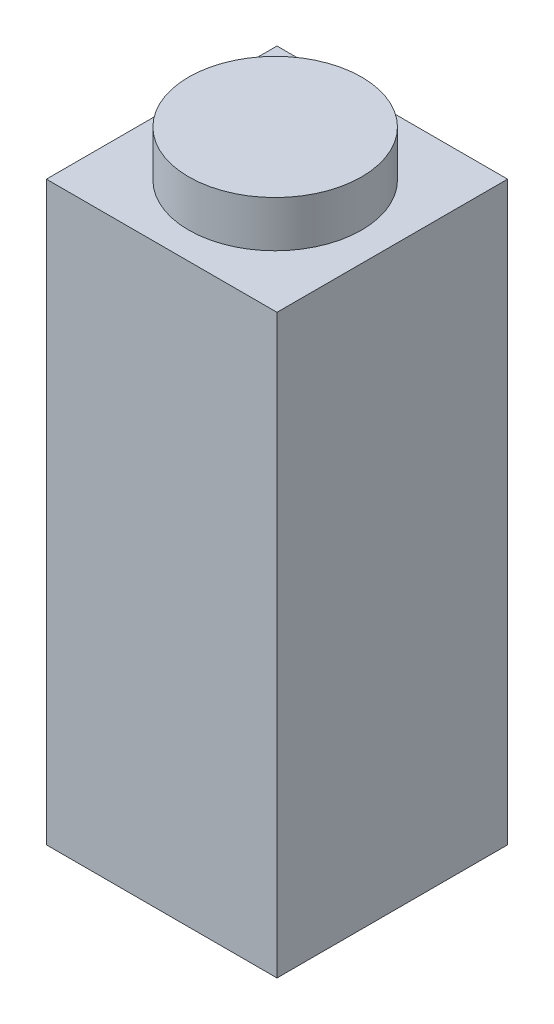
from build123d import *

# Parameters (mm, degrees)
SKETCH1_W           = 6
SKETCH1_H           = 6
BOSS_EXTRUDE1_DEPTH = 15
SKETCH2_R           = 1
CUT_EXTRUDE1_DEPTH  = 0.5
SKETCH4_R           = 2.25
BOSS_EXTRUDE2_DEPTH = 1.2


with BuildPart() as part:
    # Sketch1 → Boss-Extrude1 (new body)
    with BuildSketch(Plane(origin=(0, 0, 0), x_dir=(1, 0, 0), z_dir=(0, 1, 0))):
        Rectangle(SKETCH1_W, SKETCH1_H)
    extrude(amount=BOSS_EXTRUDE1_DEPTH)

    # Sketch2 → Cut-Extrude1 (cut)
    with BuildSketch(Plane.XZ):
        Circle(SKETCH2_R)
    extrude(amount=-CUT_EXTRUDE1_DEPTH, mode=Mode.SUBTRACT)

    # Sketch4 → Boss-Extrude2 (add)
    with BuildSketch(Plane(origin=(0, 15, 0), x_dir=(1, 0, 0), z_dir=(0, 1, 0))):
        with Locations((0, -0.04771887)):
            Circle(SKETCH4_R)
    extrude(amount=BOSS_EXTRUDE2_DEPTH)


solid = part.part
